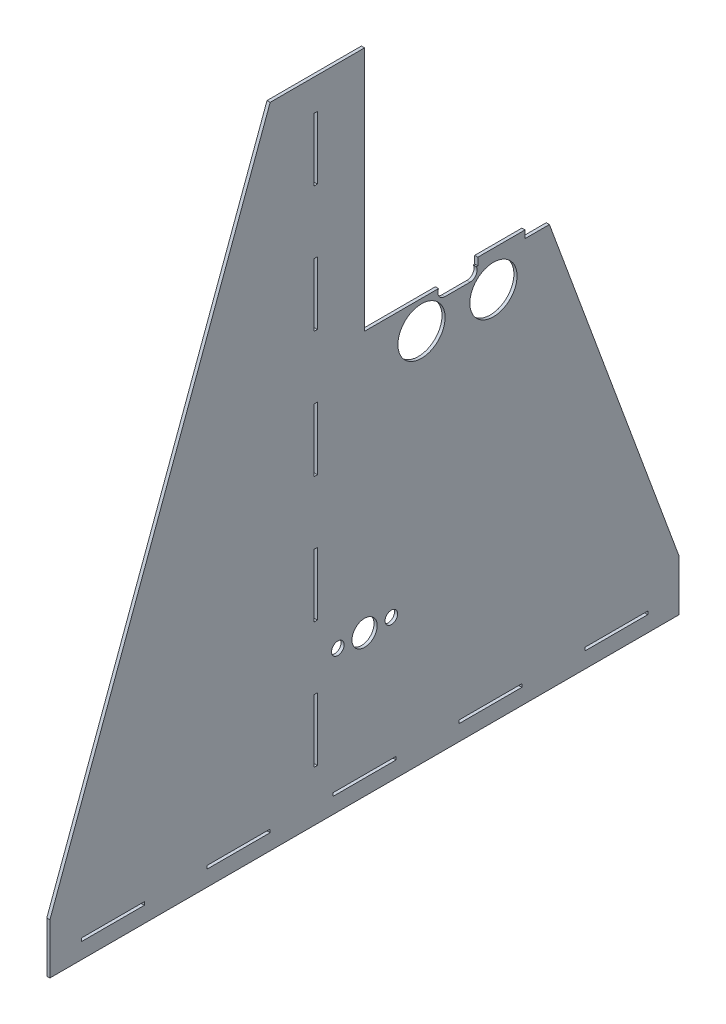
from build123d import *

# Parameters (mm, degrees)
SKICA1_R                = 4
SKICA1_W                = 20
SKICA1_H                = 1
SKICA1_W_2              = 1
SKICA1_H_2              = 20
SKICA1_R_2              = 2
SKICA1_R_3              = 7.5
P_IDAT_VYSUNUT_M1_DEPTH = 1


with BuildPart() as part:
    # Skica1 → Přidat vysunutím1 (new body)
    with BuildSketch(Plane(origin=(0, 0, 0), x_dir=(0, 0, -1), z_dir=(1, 0, 0))):
        with BuildLine():
            Line((-100, 0), (100, 0))
            Line((100, 0), (100, 16))
            Line((100, 16), (58.736842105, 128))
            Line((58.736842105, 128), (51, 128))
            Line((51, 128), (51, 130.390761593))
            Line((51, 130.390761593), (36, 130.390761593))
            Line((36, 130.390761593), (36, 128))
            Line((36, 128), (35.537819887, 128))
            ThreePointArc((35.537819887, 128), (35.434387767, 125.814145877), (33.52225545, 124.75))
            Line((33.52225545, 124.75), (25.52225545, 124.75))
            ThreePointArc((25.52225545, 124.75), (23.610123132, 125.814145877), (23.506691013, 128))
            Line((23.506691013, 128), (0, 128))
            Line((0, 128), (0, 206))
            Line((0, 206), (-30, 206))
            Line((-30, 206), (-100, 16))
            Line((-100, 16), (-100, 0))
        make_face()
        with Locations((0, 45)):
            Circle(SKICA1_R, mode=Mode.SUBTRACT)
        with Locations((0, 5.5)):
            Rectangle(SKICA1_W, SKICA1_H, mode=Mode.SUBTRACT)
        with Locations((-80, 5.5)):
            Rectangle(SKICA1_W, SKICA1_H, mode=Mode.SUBTRACT)
        with Locations((-40, 5.5)):
            Rectangle(SKICA1_W, SKICA1_H, mode=Mode.SUBTRACT)
        with Locations((-15.5, 26)):
            Rectangle(SKICA1_W_2, SKICA1_H_2, mode=Mode.SUBTRACT)
        with Locations((-8.5, 45)):
            Circle(SKICA1_R_2, mode=Mode.SUBTRACT)
        with Locations((-15.5, 66)):
            Rectangle(SKICA1_W_2, SKICA1_H_2, mode=Mode.SUBTRACT)
        with Locations((-15.5, 106)):
            Rectangle(SKICA1_W_2, SKICA1_H_2, mode=Mode.SUBTRACT)
        with Locations((-15.5, 146)):
            Rectangle(SKICA1_W_2, SKICA1_H_2, mode=Mode.SUBTRACT)
        with Locations((-15.5, 186)):
            Rectangle(SKICA1_W_2, SKICA1_H_2, mode=Mode.SUBTRACT)
        with Locations((80, 5.5)):
            Rectangle(SKICA1_W, SKICA1_H, mode=Mode.SUBTRACT)
        with Locations((18.09225545, 119)):
            Circle(SKICA1_R_3, mode=Mode.SUBTRACT)
        with Locations((40.95225545, 119)):
            Circle(SKICA1_R_3, mode=Mode.SUBTRACT)
        with Locations((40, 5.5)):
            Rectangle(SKICA1_W, SKICA1_H, mode=Mode.SUBTRACT)
        with Locations((8.5, 45)):
            Circle(SKICA1_R_2, mode=Mode.SUBTRACT)
    extrude(amount=P_IDAT_VYSUNUT_M1_DEPTH)


solid = part.part
